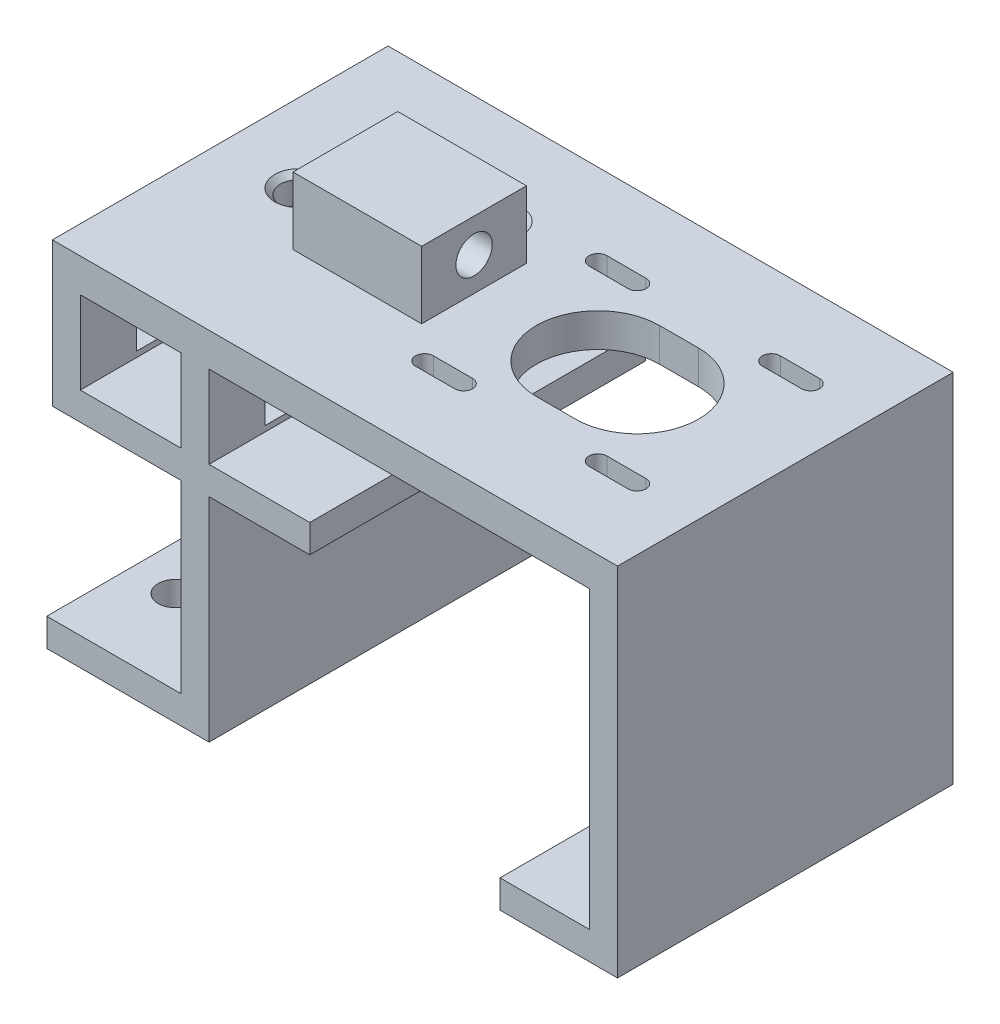
from build123d import *

# Parameters (mm, degrees)
SKETCH1_W           = 18
SKETCH1_H           = 14.75
BOSS_EXTRUDE1_DEPTH = 60
CUT_EXTRUDE1_REACH  = 123.108
SKETCH2_W           = 40
SKETCH2_H           = 14.75
CUT_EXTRUDE2_REACH  = 115.987
CUT_EXTRUDE3_REACH  = 123.108
SKETCH5_R           = 3.25
CUT_EXTRUDE4_REACH  = 105.817
SKETCH6_R           = 2.6
SKETCH7_R           = 2.6
CUT_EXTRUDE5_DEPTH  = 114.9871155
CUT_EXTRUDE6_REACH  = 115.987
SKETCH8_R           = 3.25
SKETCH9_W           = 23
SKETCH9_H           = 21.27
SKETCH9_H_2         = 20
CUT_EXTRUDE7_DEPTH  = 12
CHAMFER1_SIZE       = 1
CUT_EXTRUDE8_REACH  = 123.108
SKETCH10_R          = 3.1
SKETCH10_R_2        = 2.6
SKETCH11_R          = 3.25
CUT_EXTRUDE9_DEPTH  = 125.185596991
CHAMFER2_SIZE       = 1


with BuildPart() as part:
    # Sketch1 → Boss-Extrude1 (new body)
    with BuildSketch(Plane.XY):
        Polygon((0, 0), (-29, 0), (-29, 5), (-5, 5), (-5, 38), (-28, 38), (-28, 63.75), (-5, 63.75), (-5, 75.75), (18, 75.75), (18, 63.75), (73, 63.75), (73, 0), (52, 0), (52, 5), (68, 5), (68, 57.75), (0, 57.75), (0, 43), (18, 43), (18, 38), (0, 38), align=None)
        with Locations((-14, 50.375)):
            Rectangle(SKETCH1_W, SKETCH1_H, mode=Mode.SUBTRACT)
    extrude(amount=BOSS_EXTRUDE1_DEPTH)

    # Sketch2 → Cut-Extrude1 (cut, up to next)
    with BuildSketch(Plane(origin=(0, 0, 0), x_dir=(0, 0, -1), z_dir=(1, 0, 0)), mode=Mode.PRIVATE) as cut_extrude1_sk1:
        with Locations((-30, 51.375)):
            Rectangle(SKETCH2_W, SKETCH2_H)
    cut_extrude1_tool1 = extrude(cut_extrude1_sk1.sketch, amount=-CUT_EXTRUDE1_REACH, mode=Mode.PRIVATE) & part.part
    add(cut_extrude1_tool1.solids().sort_by_distance((0, 51.375, 30))[0], mode=Mode.SUBTRACT)

    # Sketch3 → Cut-Extrude2 (cut, up to next)
    with BuildSketch(Plane(origin=(0, 63.75, 0), x_dir=(1, 0, 0), z_dir=(0, 1, 0)), mode=Mode.PRIVATE) as cut_extrude2_sk1:
        with BuildLine():
            Line((39.5, -19), (46.5, -19))
            ThreePointArc((46.5, -19), (57.5, -30), (46.5, -41))
            Line((46.5, -41), (39.5, -41))
            ThreePointArc((39.5, -41), (28.5, -30), (39.5, -19))
        make_face()
    cut_extrude2_tool1 = extrude(cut_extrude2_sk1.sketch, amount=-CUT_EXTRUDE2_REACH, mode=Mode.PRIVATE) & part.part
    # Sketch3 → Cut-Extrude2 (cut, up to next)
    with BuildSketch(Plane(origin=(0, 63.75, 0), x_dir=(1, 0, 0), z_dir=(0, 1, 0)), mode=Mode.PRIVATE) as cut_extrude2_sk2:
        with BuildLine():
            Line((31, -16.1), (24, -16.1))
            ThreePointArc((24, -16.1), (22.4, -14.5), (24, -12.9))
            Line((24, -12.9), (31, -12.9))
            ThreePointArc((31, -12.9), (32.6, -14.5), (31, -16.1))
        make_face()
    cut_extrude2_tool2 = extrude(cut_extrude2_sk2.sketch, amount=-CUT_EXTRUDE2_REACH, mode=Mode.PRIVATE) & part.part
    # Sketch3 → Cut-Extrude2 (cut, up to next)
    with BuildSketch(Plane(origin=(0, 63.75, 0), x_dir=(1, 0, 0), z_dir=(0, 1, 0)), mode=Mode.PRIVATE) as cut_extrude2_sk3:
        with BuildLine():
            Line((55, -16.1), (62, -16.1))
            ThreePointArc((62, -16.1), (63.6, -14.5), (62, -12.9))
            Line((62, -12.9), (55, -12.9))
            ThreePointArc((55, -12.9), (53.4, -14.5), (55, -16.1))
        make_face()
    cut_extrude2_tool3 = extrude(cut_extrude2_sk3.sketch, amount=-CUT_EXTRUDE2_REACH, mode=Mode.PRIVATE) & part.part
    # Sketch3 → Cut-Extrude2 (cut, up to next)
    with BuildSketch(Plane(origin=(0, 63.75, 0), x_dir=(1, 0, 0), z_dir=(0, 1, 0)), mode=Mode.PRIVATE) as cut_extrude2_sk4:
        with BuildLine():
            Line((31, -43.9), (24, -43.9))
            ThreePointArc((24, -43.9), (22.4, -45.5), (24, -47.1))
            Line((24, -47.1), (31, -47.1))
            ThreePointArc((31, -47.1), (32.6, -45.5), (31, -43.9))
        make_face()
    cut_extrude2_tool4 = extrude(cut_extrude2_sk4.sketch, amount=-CUT_EXTRUDE2_REACH, mode=Mode.PRIVATE) & part.part
    # Sketch3 → Cut-Extrude2 (cut, up to next)
    with BuildSketch(Plane(origin=(0, 63.75, 0), x_dir=(1, 0, 0), z_dir=(0, 1, 0)), mode=Mode.PRIVATE) as cut_extrude2_sk5:
        with BuildLine():
            Line((55, -43.9), (62, -43.9))
            ThreePointArc((62, -43.9), (63.6, -45.5), (62, -47.1))
            Line((62, -47.1), (55, -47.1))
            ThreePointArc((55, -47.1), (53.4, -45.5), (55, -43.9))
        make_face()
    cut_extrude2_tool5 = extrude(cut_extrude2_sk5.sketch, amount=-CUT_EXTRUDE2_REACH, mode=Mode.PRIVATE) & part.part
    add(cut_extrude2_tool1.solids().sort_by_distance((43, 63.75, 30))[0], mode=Mode.SUBTRACT)
    add(cut_extrude2_tool2.solids().sort_by_distance((27.5, 63.75, 14.5))[0], mode=Mode.SUBTRACT)
    add(cut_extrude2_tool3.solids().sort_by_distance((58.5, 63.75, 14.5))[0], mode=Mode.SUBTRACT)
    add(cut_extrude2_tool4.solids().sort_by_distance((27.5, 63.75, 45.5))[0], mode=Mode.SUBTRACT)
    add(cut_extrude2_tool5.solids().sort_by_distance((58.5, 63.75, 45.5))[0], mode=Mode.SUBTRACT)

    # Sketch5 → Cut-Extrude3 (cut, up to next)
    with BuildSketch(Plane(origin=(0, 75.75, 0), x_dir=(1, 0, 0), z_dir=(0, 1, 0)), mode=Mode.PRIVATE) as cut_extrude3_sk1:
        with Locations(Location((9, -17.27, 0), (0, 0, 180))):
            Circle(SKETCH5_R)
    cut_extrude3_tool1 = extrude(cut_extrude3_sk1.sketch, amount=-CUT_EXTRUDE3_REACH, mode=Mode.PRIVATE) & part.part
    add(cut_extrude3_tool1.solids().sort_by_distance((9, 75.75, 17.27))[0], mode=Mode.SUBTRACT)

    # Sketch6 → Cut-Extrude4 (cut, up to next)
    with BuildSketch(Plane(origin=(0, 43, 0), x_dir=(1, 0, 0), z_dir=(0, 1, 0)), mode=Mode.PRIVATE) as cut_extrude4_sk1:
        with Locations(Location((9, -17.27, 0), (0, 0, 270))):
            Circle(SKETCH6_R)
    cut_extrude4_tool1 = extrude(cut_extrude4_sk1.sketch, amount=-CUT_EXTRUDE4_REACH, mode=Mode.PRIVATE) & part.part
    add(cut_extrude4_tool1.solids().sort_by_distance((9, 43, 17.27))[0], mode=Mode.SUBTRACT)

    # Sketch7 → Cut-Extrude5 (cut, through all)
    with BuildSketch(Plane(origin=(0, 63.75, 0), x_dir=(1, 0, 0), z_dir=(0, 1, 0))):
        with Locations(Location((-14, -30, 0), (0, 0, 270))):
            Circle(SKETCH7_R)
    extrude(amount=-CUT_EXTRUDE5_DEPTH, mode=Mode.SUBTRACT)

    # Sketch8 → Cut-Extrude6 (cut, up to next)
    with BuildSketch(Plane(origin=(0, 63.75, 0), x_dir=(1, 0, 0), z_dir=(0, 1, 0)), mode=Mode.PRIVATE) as cut_extrude6_sk1:
        with Locations(Location((-14, -30, 0), (0, 0, 270))):
            Circle(SKETCH8_R)
    cut_extrude6_tool1 = extrude(cut_extrude6_sk1.sketch, amount=-CUT_EXTRUDE6_REACH, mode=Mode.PRIVATE) & part.part
    add(cut_extrude6_tool1.solids().sort_by_distance((-14, 63.75, 30))[0], mode=Mode.SUBTRACT)

    # Sketch9 → Cut-Extrude7 (cut)
    with BuildSketch(Plane(origin=(0, 75.75, 0), x_dir=(1, 0, 0), z_dir=(0, 1, 0))):
        with Locations((6.5, -10.635)):
            Rectangle(SKETCH9_W, SKETCH9_H)
        with Locations((6.5, -50)):
            Rectangle(SKETCH9_W, SKETCH9_H_2)
    extrude(amount=-CUT_EXTRUDE7_DEPTH, mode=Mode.SUBTRACT)

    # Chamfer1
    # the kernel refuses this chamfer: 1 mm, written as the material it takes off along each edge
    with BuildSketch(Plane(origin=(-14, 63.75, 30), x_dir=(0, 0, 1), z_dir=(-1, 0, 0))) as chamfer1_piece_1:
        Polygon((3.25, -CHAMFER1_SIZE), (3.25 + CHAMFER1_SIZE, 0), (3.25, 0), align=None)
    revolve(axis=Axis((-14, 63.75, 30), (0, 1, 0)), mode=Mode.SUBTRACT)
    with BuildSketch(Plane(origin=(9, 63.75, 17.27), x_dir=(-1, 0, 0), z_dir=(0, 0, -1))) as chamfer1_piece_2_section:
        Polygon((3.25 + CHAMFER1_SIZE, 0), (3.25, -CHAMFER1_SIZE), (3.25, 0), align=None)
    chamfer1_piece_2 = revolve(axis=Axis((9, 63.75, 17.27), (0, 1, 0)), mode=Mode.PRIVATE)
    chamfer1_piece_2 = split(chamfer1_piece_2, bisect_by=Plane(origin=(12.733674615, 63.266325385, 21.27), z_dir=(0, 0, -1)), keep=Keep.TOP, mode=Mode.PRIVATE)
    add(chamfer1_piece_2, mode=Mode.SUBTRACT)

    # Sketch10 → Cut-Extrude8 (cut, up to next)
    with BuildSketch(Plane.XZ, mode=Mode.PRIVATE) as cut_extrude8_sk1:
        with Locations((-21, 45)):
            Circle(SKETCH10_R)
    cut_extrude8_tool1 = extrude(cut_extrude8_sk1.sketch, amount=-CUT_EXTRUDE8_REACH, mode=Mode.PRIVATE) & part.part
    # Sketch10 → Cut-Extrude8 (cut, up to next)
    with BuildSketch(Plane.XZ, mode=Mode.PRIVATE) as cut_extrude8_sk2:
        with Locations((-21, 15)):
            Circle(SKETCH10_R)
    cut_extrude8_tool2 = extrude(cut_extrude8_sk2.sketch, amount=-CUT_EXTRUDE8_REACH, mode=Mode.PRIVATE) & part.part
    # Sketch10 → Cut-Extrude8 (cut, up to next)
    with BuildSketch(Plane.XZ, mode=Mode.PRIVATE) as cut_extrude8_sk3:
        with Locations((60, 15)):
            Circle(SKETCH10_R_2)
    cut_extrude8_tool3 = extrude(cut_extrude8_sk3.sketch, amount=-CUT_EXTRUDE8_REACH, mode=Mode.PRIVATE) & part.part
    # Sketch10 → Cut-Extrude8 (cut, up to next)
    with BuildSketch(Plane.XZ, mode=Mode.PRIVATE) as cut_extrude8_sk4:
        with Locations((60, 45)):
            Circle(SKETCH10_R_2)
    cut_extrude8_tool4 = extrude(cut_extrude8_sk4.sketch, amount=-CUT_EXTRUDE8_REACH, mode=Mode.PRIVATE) & part.part
    add(cut_extrude8_tool1.solids().sort_by_distance((-21, 0, 45))[0], mode=Mode.SUBTRACT)
    add(cut_extrude8_tool2.solids().sort_by_distance((-21, 0, 15))[0], mode=Mode.SUBTRACT)
    add(cut_extrude8_tool3.solids().sort_by_distance((60, 0, 15))[0], mode=Mode.SUBTRACT)
    add(cut_extrude8_tool4.solids().sort_by_distance((60, 0, 45))[0], mode=Mode.SUBTRACT)

    # Sketch11 → Cut-Extrude9 (cut, through all)
    with BuildSketch(Plane.ZY.offset(5)):
        with Locations(Location((30.635, 69.75, 0), (0, 0, 270))):
            Circle(SKETCH11_R)
    extrude(amount=-CUT_EXTRUDE9_DEPTH, mode=Mode.SUBTRACT)

    # Chamfer2
    chamfer2_edges = [part.edges().sort_by_distance(p)[0] for p in [
        (-5, 73, 30.635),
    ]]
    chamfer(chamfer2_edges, length=CHAMFER2_SIZE)


solid = part.part
